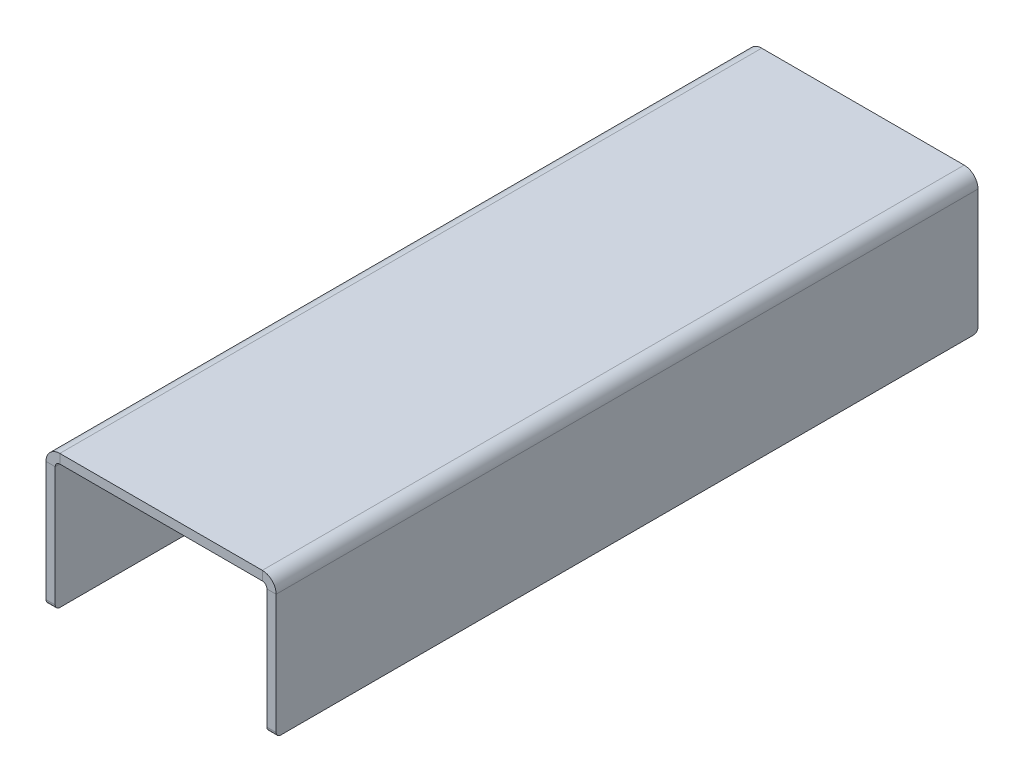
from build123d import *

# Parameters (mm, degrees)
EXTRUDE_THIN1_DEPTH    = 152.5
CONVERT_SOLID1_START   = -152.5
CONVERT_SOLID1_DEPTH   = 305
CONVERT_SOLID1_2_DEPTH = 305
FILLET1_R              = 2


# Read off the part's stored shape, not the designer's step: Convert-Solid1
with BuildPart() as part:
    # Sketch1 → Extrude-Thin1 (new, symmetric)
    with BuildSketch(Plane.XY):
        Polygon((-50, -60), (-50, 0), (50, 0), (50, -60), (46, -60), (46, -4), (-46, -4), (-46, -60), align=None)
    extrude(amount=EXTRUDE_THIN1_DEPTH, both=True)

    # Convert-Solid1 outline → Convert-Solid1 (cut)
    with BuildSketch(Plane.XY.offset(CONVERT_SOLID1_START)):
        with BuildLine():
            Line((50, 0), (44, 0))
            ThreePointArc((44, 0), (48.242640687, -1.757359313), (50, -6))
            Line((50, -6), (50, 0))
        make_face()
        with BuildLine():
            ThreePointArc((-50, -6), (-48.242640687, -1.757359313), (-44, 0))
            Line((-44, 0), (-50, 0))
            Line((-50, 0), (-50, -6))
        make_face()
    extrude(amount=CONVERT_SOLID1_DEPTH, mode=Mode.SUBTRACT)

    # Convert-Solid1 2 outline → Convert-Solid1 2 (add)
    with BuildSketch(Plane.XY.offset(CONVERT_SOLID1_START)):
        with BuildLine():
            Line((46, -4), (44, -4))
            ThreePointArc((44, -4), (45.414213562, -4.585786438), (46, -6))
            Line((46, -6), (46, -4))
        make_face()
        with BuildLine():
            ThreePointArc((-46, -6), (-45.414213562, -4.585786438), (-44, -4))
            Line((-44, -4), (-46, -4))
            Line((-46, -4), (-46, -6))
        make_face()
    extrude(amount=CONVERT_SOLID1_2_DEPTH)

    # Fillet1
    fillet1_edges = [part.edges().sort_by_distance(p)[0] for p in [
        (48, -60, 152.5),
        (48, -60, -152.5),
        (-48, -60, -152.5),
        (-48, -60, 152.5),
    ]]
    fillet(fillet1_edges, radius=FILLET1_R)


solid = part.part
